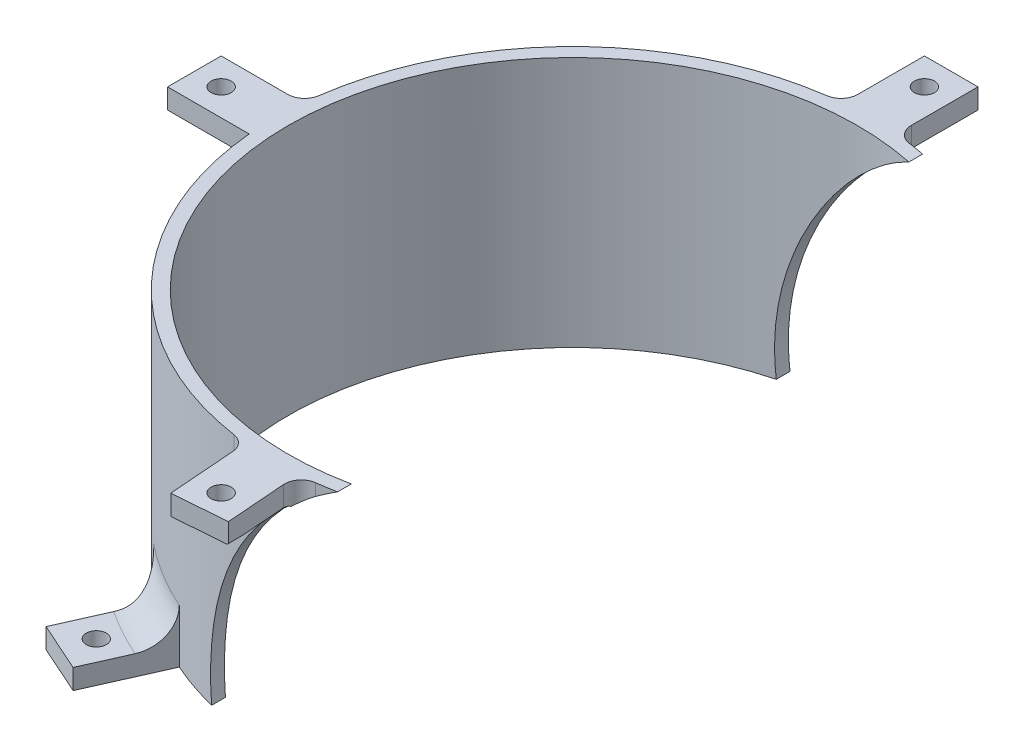
from build123d import *

# Parameters (mm, degrees)
SKETCH1_R               = 89
SKETCH1_R_2             = 85
BOSS_EXTRUDE1_DEPTH     = 75
BOSS_EXTRUDE2_START     = -6
SKETCH2_R               = 3
BOSS_EXTRUDE2_DEPTH     = 6
FILLET1_R               = 5
BOSS_EXTRUDE3_DEPTH     = 6
FILLET2_R               = 10
SKETCH4_R               = 3
CUT_EXTRUDE1_DEPTH      = 175.066079576
CUT_EXTRUDE2_DEPTH      = 177.530450802
CUT_EXTRUDE2_DEPTH_BACK = 177.530450802


with BuildPart() as part:
    # Sketch1 → Boss-Extrude1 (new body)
    with BuildSketch(Plane(origin=(0, 0, 0), x_dir=(1, 0, 0), z_dir=(0, 1, 0))):
        Circle(SKETCH1_R)
        Circle(SKETCH1_R_2, mode=Mode.SUBTRACT)
    extrude(amount=BOSS_EXTRUDE1_DEPTH)

    # Sketch2 → Boss-Extrude2 (add)
    # profile 1 of 3: a face of its own
    with BuildSketch(Plane(origin=(0, 75, 0), x_dir=(1, 0, 0), z_dir=(0, 1, 0)).offset(BOSS_EXTRUDE2_START)):
        with BuildLine():
            ThreePointArc((-8, 88.639720216), (0, 89), (8, 88.639720216))
            Line((8, 88.639720216), (8, 113))
            Line((8, 113), (-8, 113))
            Line((-8, 113), (-8, 88.639720216))
        make_face()
        with Locations((0, 105)):
            Circle(SKETCH2_R, mode=Mode.SUBTRACT)
    # profile 2 of 3: a face of its own
    with BuildSketch(Plane(origin=(0, 75, 0), x_dir=(1, 0, 0), z_dir=(0, 1, 0)).offset(BOSS_EXTRUDE2_START)):
        with BuildLine():
            Line((8.510079583, -111.370129159), (6.780952381, -88.741302023))
            ThreePointArc((6.780952381, -88.741302023), (-1.2561594, -88.991134747), (-9.283017396, -88.514550149))
            Line((-9.283017396, -88.514550149), (-7.443412916, -112.589176778))
            Line((-7.443412916, -112.589176778), (8.510079583, -111.370129159))
        make_face()
        with Locations((0, -105)):
            Circle(SKETCH2_R, mode=Mode.SUBTRACT)
    # profile 3 of 3: a face of its own
    with BuildSketch(Plane(origin=(0, 75, 0), x_dir=(1, 0, 0), z_dir=(0, 1, 0)).offset(BOSS_EXTRUDE2_START)):
        with BuildLine():
            ThreePointArc((-88.639720216, -8), (-89, 0), (-88.639720216, 8))
            Line((-88.639720216, 8), (-113, 8))
            Line((-113, 8), (-113, -8))
            Line((-113, -8), (-88.639720216, -8))
        make_face()
        with Locations((-105, 0)):
            Circle(SKETCH2_R, mode=Mode.SUBTRACT)
    extrude(amount=BOSS_EXTRUDE2_DEPTH)

    # Fillet1
    fillet1_edges = [part.edges().sort_by_distance(p)[0] for p in [
        (-89, 69, 0),
        (-88.639720216, 72, -8),
        (0, 69, -89),
        (-1.2561594, 69, 88.991134747),
        (-8, 72, -88.639720216),
        (8, 72, -88.639720216),
        (6.780952381, 72, 88.741302023),
        (-9.283017396, 72, 88.514550149),
    ]]
    fillet(fillet1_edges, radius=FILLET1_R)

    # Sketch3 → Boss-Extrude3 (add)
    with BuildSketch(Plane.XZ):
        Polygon((-113, 8), (-88.639720216, 8), (-86.576800688, 8), (-86.576800688, -8), (-88.639720216, -8), (-113, -8), align=None)
        Polygon((-45.961240668, -103.230636714), (-35.105734736, -78.848771193), (-49.461433174, -71.75470443), (-60.57796799, -96.722850424), align=None)
        Polygon((-35.528688012, 79.798739803), (-45.961240668, 103.230636714), (-60.57796799, 96.722850424), (-48.938573912, 70.580343301), align=None)
    extrude(amount=-BOSS_EXTRUDE3_DEPTH)

    # Fillet2
    fillet2_edges = [part.edges().sort_by_distance(p)[0] for p in [
        (-88.639720216, 3, -8),
        (-88.639720216, 3, 8),
        (-89, 6, 0),
        (-43.390130523, 6, -77.706477035),
        (-50.226514616, 3, -73.473105484),
        (-43.390130523, 6, 77.706477035),
        (-50.226514616, 3, 73.473105484),
    ]]
    fillet(fillet2_edges, radius=FILLET2_R)

    # Sketch4 → Cut-Extrude1 (cut, through all)
    with BuildSketch(Plane(origin=(0, 6, 0), x_dir=(1, 0, 0), z_dir=(0, 1, 0))):
        with Locations((-105, 0)):
            Circle(SKETCH4_R)
        with Locations((-49.891572933, -92.38956083)):
            Circle(SKETCH4_R)
        with Locations((-49.891572933, 92.38956083)):
            Circle(SKETCH4_R)
    extrude(amount=-CUT_EXTRUDE1_DEPTH, mode=Mode.SUBTRACT)

    # Sketch5 → Cut-Extrude2 (cut, two sides: drawn at the far end of the back side and taken through both)
    with BuildSketch(Plane.XY.offset(-CUT_EXTRUDE2_DEPTH_BACK)):
        with BuildLine():
            Line((89, 77.46972151), (165.957699514, -10.535724009))
            Line((165.957699514, -10.535724009), (27.435871155, -65.876767842))
            Line((27.435871155, -65.876767842), (-25.198261147, -65.876767842))
            Line((-25.198261147, -65.876767842), (-21.488596465, 0))
            ThreePointArc((-21.488596465, 0), (11.032289957, 71.143366025), (89, 77.46972151))
        make_face()
    extrude(amount=CUT_EXTRUDE2_DEPTH + CUT_EXTRUDE2_DEPTH_BACK, mode=Mode.SUBTRACT)


solid = part.part
